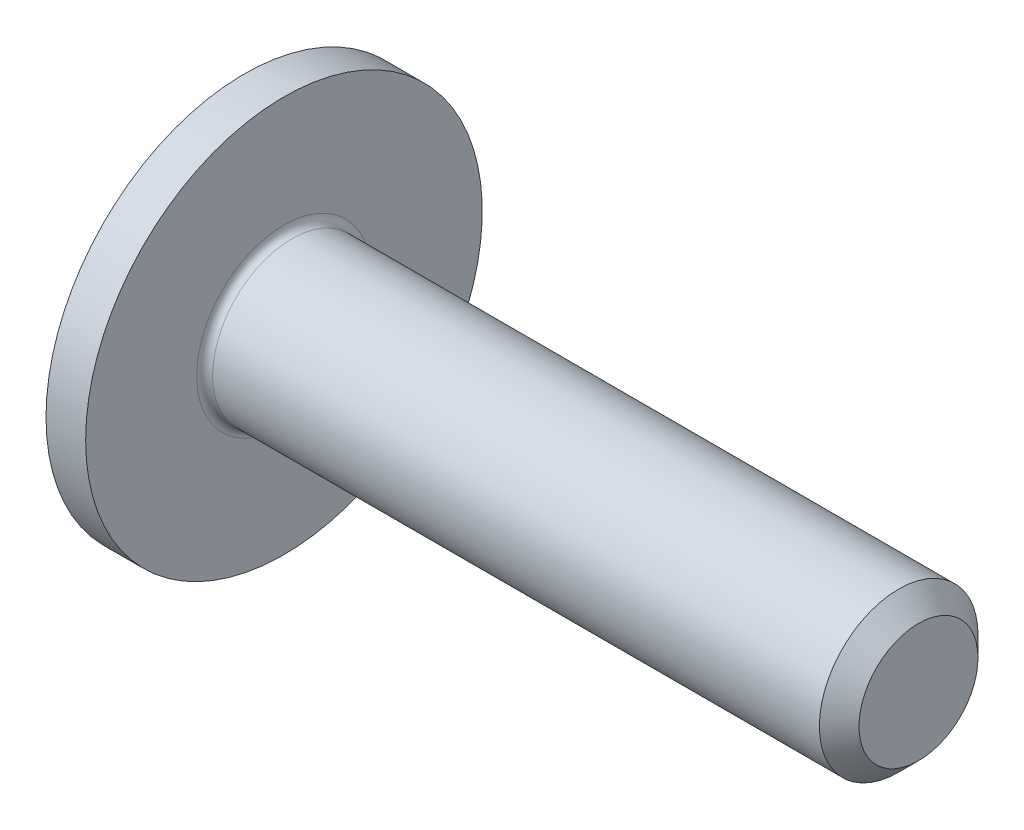
from build123d import *

# Parameters (mm, degrees)
FILLET1_R             = 0.2
RECPAT_COUNT          = 2
RECPAT_ANGLE          = 90
CHAMFER_1_SIZE        = 0.5
CUT_EXTRUDE_START     = -1.932317225
CUT_EXTRUDE_1_DEPTH   = 0.992538955
CUT_EXTRUDE_1_2_DEPTH = 0.992538955
CUT_EXTRUDE_1_3_DEPTH = 0.992538955
CUT_EXTRUDE_1_4_DEPTH = 0.992538955


# Read off the part's stored shape, not the designer's step: Вытянуть1
with BuildPart() as part:
    # BodySke → Base-Revolve (revolve)
    with BuildSketch(Plane.XY, mode=Mode.PRIVATE) as base_revolve_sk:
        Polygon((3.05, 2), (3.05, 5), (2.05, 5), (2.05, 0), (19.05, 0), (19.05, 2), align=None)
    revolve(base_revolve_sk.sketch.rotate(Axis((-6.35, 0, 0), (1, 0, 0)), 90), axis=Axis((-6.35, 0, 0), (1, 0, 0)))

    # Fillet1
    fillet1_edges = [part.edges().sort_by_distance(p)[0] for p in [
        (3.05, 0, -2),
    ]]
    fillet(fillet1_edges, radius=FILLET1_R)

    # PanSke → Pan (revolve)
    with BuildSketch(Plane.XY):
        with BuildLine():
            Line((2.05, 4.424646879), (2.05, 0))
            Line((2.05, 0), (0, 0))
            ThreePointArc((0, 0), (0.537396082, 2.438237068), (2.05, 4.424646879))
        make_face()
    revolve(axis=Axis((0, 0, 0), (1, 0, 0)))

    # Sketch3 → Recess section 0
    with BuildSketch(Plane(origin=(0, 0, 0), x_dir=(0, 0, -1), z_dir=(1, 0, 0))):
        with BuildLine():
            Line((-0.515, 2.15), (0.515, 2.15))
            Line((0.515, 2.15), (0.515, -2.15))
            Line((0.515, -2.15), (-0.515, -2.15))
            Line((-0.515, -2.15), (-0.515, 2.15))
        make_face()
    # Sketch4 → Recess section 1
    with BuildSketch(Plane(origin=(2.34, 0, 0), x_dir=(0, 0, -1), z_dir=(1, 0, 0))):
        with BuildLine():
            Line((-0.37, 1.45), (0.37, 1.45))
            Line((0.37, 1.45), (0.37, -1.45))
            Line((0.37, -1.45), (-0.37, -1.45))
            Line((-0.37, -1.45), (-0.37, 1.45))
        make_face()
    recess = loft(mode=Mode.SUBTRACT)

    # RecPat: Recess ×2 about axis
    recpat_axis = Axis((0, 0, 0), (1, 0, 0))
    for i in range(1, RECPAT_COUNT):
        add(recess.rotate(recpat_axis, i * RECPAT_ANGLE / (RECPAT_COUNT - 1)), mode=Mode.SUBTRACT)

    # RecCorSke → RecessCore (revolve, cut)
    with BuildSketch(Plane.XY, mode=Mode.PRIVATE) as recesscore_sk:
        Polygon((0, 0), (0, 1.032809711), (2.6, 0.851), (2.876506661, 0), align=None)
    revolve(recesscore_sk.sketch.rotate(Axis((-3.175, 0, 0), (1, 0, 0)), 90), axis=Axis((-3.175, 0, 0), (1, 0, 0)), mode=Mode.SUBTRACT)

    # Фаска1
    chamfer_1_edges = [part.edges().sort_by_distance(p)[0] for p in [
        (19.05, 0, -2),
    ]]
    chamfer(chamfer_1_edges, length=CHAMFER_1_SIZE)

    # Вытянуть1 outline → Вытянуть1 (cut)
    with BuildSketch(Plane(origin=(0, 0, 0), x_dir=(0.9932989193126689, -0.08172287590474257, -0.08172287590474261), z_dir=(0.1155735994606204, 0.7023684015912574, 0.7023684015912578)).offset(CUT_EXTRUDE_START)):
        Polygon((-1, -0.919204654), (0.206895578, -0.216114133), (0.577867997, 0), (0.206895578, 0.216114133), (-1, 0.919204654), align=None)
    extrude(amount=CUT_EXTRUDE_1_DEPTH, mode=Mode.SUBTRACT)

    # Cut-Extrude 1 2 outline → Cut-Extrude 1 2 (cut)
    with BuildSketch(Plane(origin=(0, 0, 0), x_dir=(0.9932989193126689, -0.08172287590474257, 0.08172287590474261), z_dir=(0.1155735994606204, 0.7023684015912574, -0.7023684015912578)).offset(CUT_EXTRUDE_START)):
        Polygon((0.206895578, -0.216114133), (0.577867997, 0), (0.206895578, 0.216114133), (-1, 0.919204654), (-1, -0.919204654), align=None)
    extrude(amount=CUT_EXTRUDE_1_2_DEPTH, mode=Mode.SUBTRACT)

    # Cut-Extrude 1 3 outline → Cut-Extrude 1 3 (cut)
    with BuildSketch(Plane(origin=(0, 0, 0), x_dir=(0.9932989193126689, 0.08172287590474257, 0.08172287590474261), z_dir=(0.1155735994606204, -0.7023684015912574, -0.7023684015912578)).offset(CUT_EXTRUDE_START)):
        Polygon((0.206895578, -0.216114133), (0.577867997, 0), (0.206895578, 0.216114133), (-1, 0.919204654), (-1, -0.919204654), align=None)
    extrude(amount=CUT_EXTRUDE_1_3_DEPTH, mode=Mode.SUBTRACT)

    # Cut-Extrude 1 4 outline → Cut-Extrude 1 4 (cut)
    with BuildSketch(Plane(origin=(0, 0, 0), x_dir=(0.9932989193126689, 0.08172287590474257, -0.08172287590474261), z_dir=(0.1155735994606204, -0.7023684015912574, 0.7023684015912578)).offset(CUT_EXTRUDE_START)):
        Polygon((-1, -0.919204654), (0.206895578, -0.216114133), (0.577867997, 0), (0.206895578, 0.216114133), (-1, 0.919204654), align=None)
    extrude(amount=CUT_EXTRUDE_1_4_DEPTH, mode=Mode.SUBTRACT)


solid = part.part
